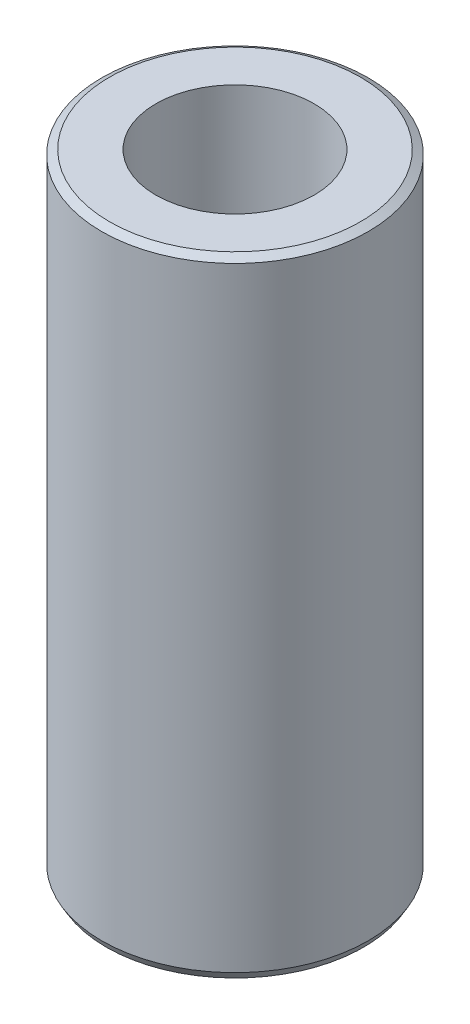
from build123d import *
from OCP.BRepFilletAPI import BRepFilletAPI_MakeChamfer

# Parameters (mm, degrees)
SKETCH1_R           = 35
BOSS_EXTRUDE1_DEPTH = 164.587406741
SKETCH2_R           = 20.796848535
CUT_EXTRUDE1_DEPTH  = 172.869178324
CHAMFER1_SIZE       = 1.19113289
CHAMFER1_SIZE2      = 2.063102685


with BuildPart() as part:
    # Sketch1 → Boss-Extrude1 (new body)
    with BuildSketch(Plane(origin=(0, 0, 0), x_dir=(1, 0, 0), z_dir=(0, 1, 0))):
        Circle(SKETCH1_R)
    extrude(amount=BOSS_EXTRUDE1_DEPTH)

    # Sketch2 → Cut-Extrude1 (cut, through all)
    with BuildSketch(Plane(origin=(0, 0, 0), x_dir=(1, 0, 0), z_dir=(0, 1, 0))):
        Circle(SKETCH2_R)
    extrude(amount=CUT_EXTRUDE1_DEPTH, mode=Mode.SUBTRACT)

    # Chamfer1: one chamfer whose edges measure the first distance from different faces: ONE call of the kernel's chamfer builder (chamfer() names one face for all edges)
    chamfer1_edges_1 = [part.edges().sort_by_distance(p)[0] for p in [
        (-35, 164.587406741, 0),
    ]]
    chamfer1_side_1 = [part.faces().sort_by_distance(p)[0] for p in [
        (-35, 82.293703371, 0),
    ]]
    chamfer1_edges_2 = [part.edges().sort_by_distance(p)[0] for p in [
        (-35, 0, 0),
    ]]
    chamfer1_side_2 = [part.faces().sort_by_distance(p)[0] for p in [
        (-34.010050506, 0, 0),
    ]]
    chamfer1 = BRepFilletAPI_MakeChamfer(part.part.solid().wrapped)
    for e in chamfer1_edges_1:
        chamfer1.Add(CHAMFER1_SIZE, CHAMFER1_SIZE2, e.wrapped, chamfer1_side_1[0].wrapped)  # the first distance lies on this face
    for e in chamfer1_edges_2:
        chamfer1.Add(CHAMFER1_SIZE, CHAMFER1_SIZE2, e.wrapped, chamfer1_side_2[0].wrapped)  # the first distance lies on this face
    add(Compound.cast(chamfer1.Shape()), mode=Mode.REPLACE)


solid = part.part
